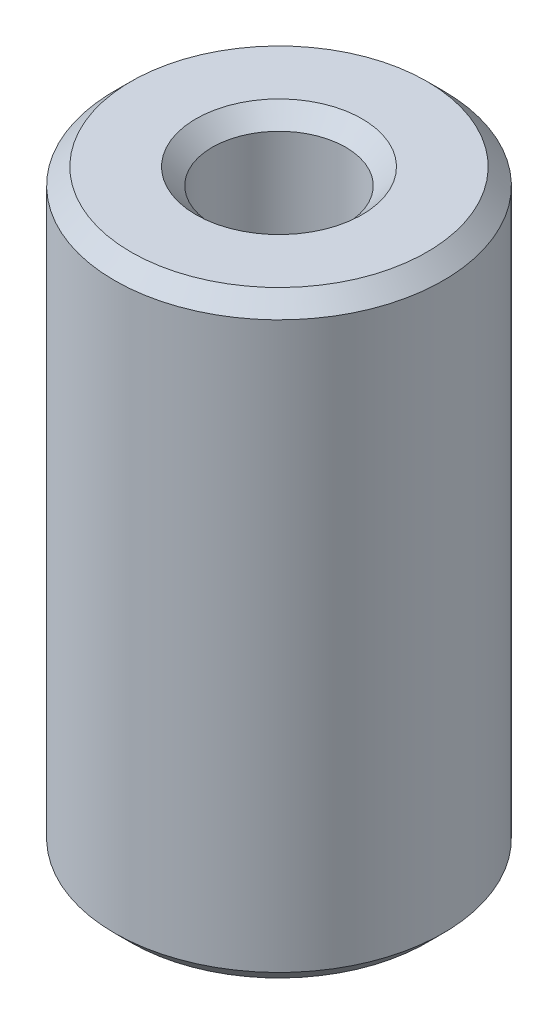
from build123d import *

# Parameters (mm, degrees)
SKETCH1_R           = 7.5
BOSS_EXTRUDE1_DEPTH = 27.291262359
SKETCH2_R           = 3.043679173
CUT_EXTRUDE1_DEPTH  = 30.279907806
CHAMFER1_SIZE       = 0.748931803


with BuildPart() as part:
    # Sketch1 → Boss-Extrude1 (new body)
    with BuildSketch(Plane(origin=(0, 0, 0), x_dir=(1, 0, 0), z_dir=(0, 1, 0))):
        Circle(SKETCH1_R)
    extrude(amount=BOSS_EXTRUDE1_DEPTH)

    # Sketch2 → Cut-Extrude1 (cut, through all)
    with BuildSketch(Plane(origin=(0, 0, 0), x_dir=(1, 0, 0), z_dir=(0, 1, 0))):
        Circle(SKETCH2_R)
    extrude(amount=CUT_EXTRUDE1_DEPTH, mode=Mode.SUBTRACT)

    # Chamfer1
    chamfer1_edges = [part.edges().sort_by_distance(p)[0] for p in [
        (-3.043679173, 27.291262359, 0),
        (-3.043679173, 0, 0),
        (-7.5, 0, 0),
        (-7.5, 27.291262359, 0),
    ]]
    chamfer(chamfer1_edges, length=CHAMFER1_SIZE)


solid = part.part
